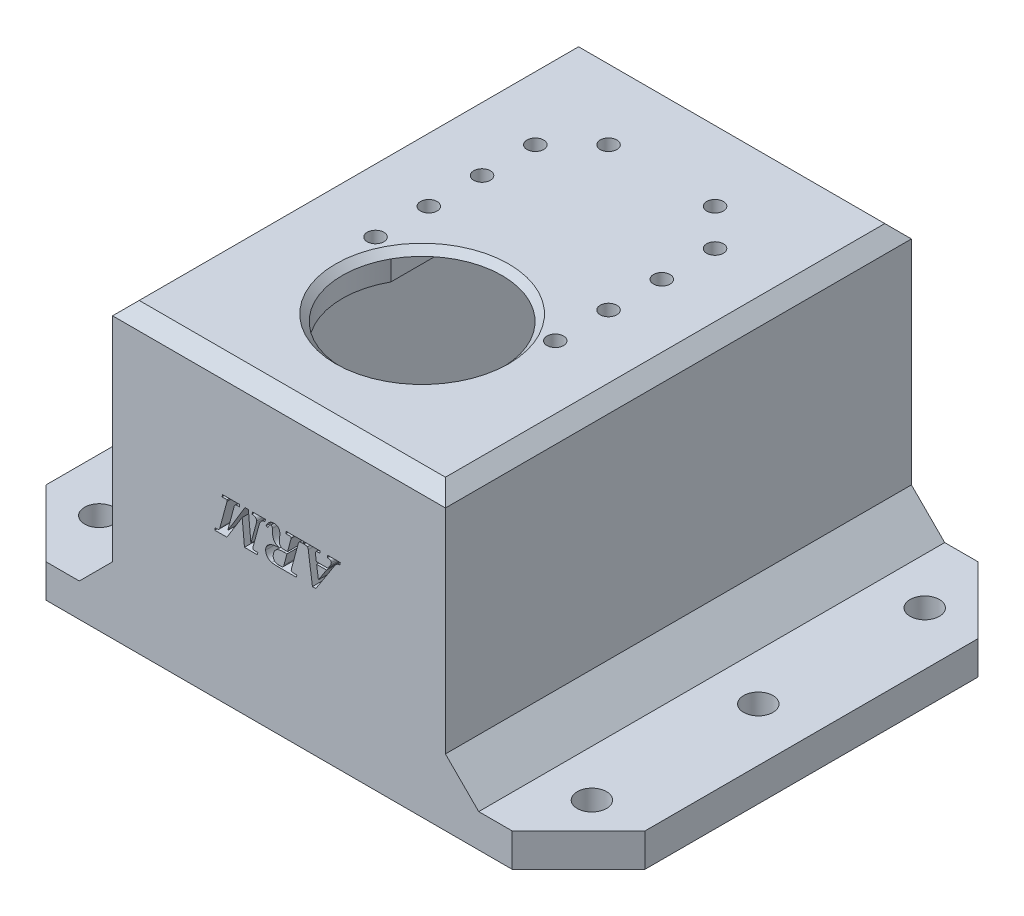
from build123d import *

# Parameters (mm, degrees)
SKETCH1_W           = 50
SKETCH1_H           = 70
BOSS_EXTRUDE1_DEPTH = 4
SKETCH3_R           = 12
CUT_EXTRUDE1_DEPTH  = 44.197222133
CUT_EXTRUDE2_DEPTH  = 3
SKETCH5_R           = 1.25
CUT_EXTRUDE3_DEPTH  = 44.197222133
SKETCH6_W           = 50
SKETCH6_H           = 70
SKETCH6_W_2         = 44
SKETCH6_H_2         = 64
BOSS_EXTRUDE2_DEPTH = 40
CHAMFER1_SIZE       = 2
CHAMFER2_SIZE       = 1
SKETCH7_W           = 20
SKETCH7_H           = 70
SKETCH7_R           = 2.2
BOSS_EXTRUDE3_DEPTH = 5
CHAMFER3_SIZE       = 10
CHAMFER4_SIZE       = 5
CUT_EXTRUDE4_DEPTH  = 5
FILLET1_R           = 2
CUT_EXTRUDE5_DEPTH  = 3


with BuildPart() as part:
    # Sketch1 → Boss-Extrude1 (new body)
    with BuildSketch(Plane(origin=(0, 0, 0), x_dir=(1, 0, 0), z_dir=(0, 1, 0))):
        Rectangle(SKETCH1_W, SKETCH1_H)
    extrude(amount=BOSS_EXTRUDE1_DEPTH)

    # Sketch3 → Cut-Extrude1 (cut, through all)
    with BuildSketch(Plane(origin=(0, 0, 0), x_dir=(-1, 0, 0), z_dir=(0, -1, 0))):
        with Locations(Location((0, -13.5, 0), (0, 0, 90))):
            Circle(SKETCH3_R)
    extrude(amount=-CUT_EXTRUDE1_DEPTH, mode=Mode.SUBTRACT)

    # Sketch4 → Cut-Extrude2 (cut)
    with BuildSketch(Plane(origin=(0, 0, 0), x_dir=(-1, 0, 0), z_dir=(0, -1, 0))):
        with BuildLine():
            Line((-10.5, 18.5), (10.5, 18.5))
            Line((10.5, 18.5), (10.5, -7.690524981))
            ThreePointArc((10.5, -7.690524981), (0, -1.5), (-10.5, -7.690524981))
            Line((-10.5, -7.690524981), (-10.5, 18.5))
        make_face()
    extrude(amount=-CUT_EXTRUDE2_DEPTH, mode=Mode.SUBTRACT)

    # Sketch5 → Cut-Extrude3 (cut, through all)
    with BuildSketch(Plane(origin=(0, 0, 0), x_dir=(-1, 0, 0), z_dir=(0, -1, 0))):
        with Locations(Location((13.5, -7, 0), (0, 0, 90))):
            Circle(SKETCH5_R)
        with Locations(Location((13.5, 1, 0), (0, 0, 90))):
            Circle(SKETCH5_R)
        with Locations(Location((13.5, 9, 0), (0, 0, 90))):
            Circle(SKETCH5_R)
        with Locations(Location((13.5, 17, 0), (0, 0, 90))):
            Circle(SKETCH5_R)
        with Locations(Location((8, 22.5, 0), (0, 0, 90))):
            Circle(SKETCH5_R)
        with Locations(Location((-8, 22.5, 0), (0, 0, 90))):
            Circle(SKETCH5_R)
        with Locations(Location((-13.5, 17, 0), (0, 0, 90))):
            Circle(SKETCH5_R)
        with Locations(Location((-13.5, 9, 0), (0, 0, 90))):
            Circle(SKETCH5_R)
        with Locations(Location((-13.5, 1, 0), (0, 0, 90))):
            Circle(SKETCH5_R)
        with Locations(Location((-13.5, -7, 0), (0, 0, 90))):
            Circle(SKETCH5_R)
    extrude(amount=-CUT_EXTRUDE3_DEPTH, mode=Mode.SUBTRACT)

    # Sketch6 → Boss-Extrude2 (add)
    with BuildSketch(Plane(origin=(0, 0, 0), x_dir=(-1, 0, 0), z_dir=(0, -1, 0))):
        Rectangle(SKETCH6_W, SKETCH6_H)
        Rectangle(SKETCH6_W_2, SKETCH6_H_2, mode=Mode.SUBTRACT)
    extrude(amount=BOSS_EXTRUDE2_DEPTH)

    # Chamfer1
    chamfer1_edges = [part.edges().sort_by_distance(p)[0] for p in [
        (-25, 4, 0),
        (0, 4, 35),
        (25, 4, 0),
        (0, 4, -35),
        (22, 0, 0),
        (0, 0, 32),
        (-22, 0, 0),
        (0, 0, -32),
    ]]
    chamfer(chamfer1_edges, length=CHAMFER1_SIZE)

    # Chamfer2
    chamfer2_edges = [part.edges().sort_by_distance(p)[0] for p in [
        (0, 4, 25.5),
    ]]
    chamfer(chamfer2_edges, length=CHAMFER2_SIZE - 0.0001)  # a hair under: the kernel refuses the full size

    # Sketch7 → Boss-Extrude3 (add)
    # profile 1 of 2: a face of its own
    with BuildSketch(Plane(origin=(0, -40, 0), x_dir=(-1, 0, 0), z_dir=(0, -1, 0))):
        with Locations((-35, 0)):
            Rectangle(SKETCH7_W, SKETCH7_H)
        with Locations(Location((-37, -25, 0), (0, 0, 90))):
            Circle(SKETCH7_R, mode=Mode.SUBTRACT)
        with Locations(Location((-37, 0, 0), (0, 0, 90))):
            Circle(SKETCH7_R, mode=Mode.SUBTRACT)
        with Locations(Location((-37, 25, 0), (0, 0, 90))):
            Circle(SKETCH7_R, mode=Mode.SUBTRACT)
    # profile 2 of 2: a face of its own
    with BuildSketch(Plane(origin=(0, -40, 0), x_dir=(-1, 0, 0), z_dir=(0, -1, 0))):
        with Locations((35, 0)):
            Rectangle(SKETCH7_W, SKETCH7_H)
        with Locations(Location((37, -25, 0), (0, 0, 90))):
            Circle(SKETCH7_R, mode=Mode.SUBTRACT)
        with Locations(Location((37, 0, 0), (0, 0, 90))):
            Circle(SKETCH7_R, mode=Mode.SUBTRACT)
        with Locations(Location((37, 25, 0), (0, 0, 90))):
            Circle(SKETCH7_R, mode=Mode.SUBTRACT)
    extrude(amount=-BOSS_EXTRUDE3_DEPTH)

    # Chamfer3
    chamfer3_edges = [part.edges().sort_by_distance(p)[0] for p in [
        (45, -37.5, -35),
        (45, -37.5, 35),
        (-45, -37.5, -35),
        (-45, -37.5, 35),
    ]]
    chamfer(chamfer3_edges, length=CHAMFER3_SIZE)

    # Chamfer4
    chamfer4_edges = [part.edges().sort_by_distance(p)[0] for p in [
        (25, -35, 0),
        (-25, -35, 0),
    ]]
    chamfer(chamfer4_edges, length=CHAMFER4_SIZE)

    # Sketch8 → Cut-Extrude4 (cut)
    with BuildSketch(Plane(origin=(0, 0, -35), x_dir=(-1, 0, 0), z_dir=(0, 0, -1))):
        Polygon((0, -40), (10, -40), (10, -35), (-10, -35), (-10, -40), align=None)
    extrude(amount=-CUT_EXTRUDE4_DEPTH, mode=Mode.SUBTRACT)

    # Fillet1
    fillet1_edges = [part.edges().sort_by_distance(p)[0] for p in [
        (10, -40, -33.5),
        (10, -35, -33.5),
        (-10, -35, -33.5),
        (-10, -40, -33.5),
    ]]
    fillet(fillet1_edges, radius=FILLET1_R)

    # Sketch9 → Cut-Extrude5 (cut)
    # profile 1 of 3: a face of its own
    with BuildSketch(Plane.XY.offset(35)):
        with BuildLine():
            Line((-3.26410099, -18.215874566), (-5.189753399, -18.215874566))
            Line((-5.189753399, -18.215874566), (-5.53141826, -14.503534355))
            Line((-5.53141826, -14.503534355), (-7.826946389, -18.215874566))
            Line((-7.826946389, -18.215874566), (-9.658562598, -18.215874566))
            Line((-9.658562598, -18.215874566), (-9.566616091, -17.881523632))
            Line((-9.566616091, -17.881523632), (-9.355557064, -17.881523632))
            add(Edge.make_bspline(
                [(-9.355557064, -17.881523632), (-9.324122948, -17.880741849), (-9.264237919, -17.879252478), (-9.17937637, -17.862058127), (-9.104120789, -17.835004896), (-9.037774986, -17.797400665), (-8.982606375, -17.74686746), (-8.936914689, -17.686011916), (-8.900869529, -17.614192881), (-8.886530434, -17.561084352), (-8.879106983, -17.533589692)],
                knots=[0, 0, 0, 0, 1.166550711, 2.222391886, 3.200926143, 4.12876701, 5.035888217, 5.959930519, 6.943841612, 8, 8, 8, 8], degree=3))
            Line((-8.879106983, -17.533589692), (-7.822767002, -13.609145607))
            add(Edge.make_bspline(
                [(-7.822767002, -13.609145607), (-7.819454863, -13.595280033), (-7.812971938, -13.568140633), (-7.812533147, -13.540245952), (-7.812318536, -13.526602721)],
                knots=[0, 0, 0, 0, 1.021804027, 2, 2, 2, 2], degree=3))
            add(Edge.make_bspline(
                [(-7.812318536, -13.526602721), (-7.813136648, -13.512586829), (-7.814701406, -13.485779406), (-7.826127896, -13.44823119), (-7.846451918, -13.416167576), (-7.866112159, -13.40138342), (-7.876054182, -13.393907194)],
                knots=[0, 0, 0, 0, 1.093673978, 2.091810004, 3.035043977, 4, 4, 4, 4], degree=3))
            add(Edge.make_bspline(
                [(-7.876054182, -13.393907194), (-7.89037957, -13.384622692), (-7.920004611, -13.365422252), (-7.972040587, -13.347108987), (-8.030981666, -13.33690247), (-8.072439795, -13.335235181), (-8.094427136, -13.334350934)],
                knots=[0, 0, 0, 0, 0.888245984, 1.836901271, 2.852799465, 4, 4, 4, 4], degree=3))
            Line((-8.094427136, -13.334350934), (-8.56042875, -13.334350934))
            Line((-8.56042875, -13.334350934), (-8.468482243, -13))
            Line((-8.468482243, -13), (-5.8950249, -13))
            Line((-5.8950249, -13), (-5.972343554, -13.334350934))
            Line((-5.972343554, -13.334350934), (-6.289976941, -13.334350934))
            add(Edge.make_bspline(
                [(-6.289976941, -13.334350934), (-6.317890308, -13.335010241), (-6.371300064, -13.336271767), (-6.4474894, -13.349709155), (-6.514647027, -13.373217478), (-6.575072264, -13.402727662), (-6.624608217, -13.444904502), (-6.666318276, -13.494886171), (-6.699035263, -13.554233621), (-6.713171508, -13.59806122), (-6.720453768, -13.620638921)],
                knots=[0, 0, 0, 0, 1.190709943, 2.278318021, 3.284337852, 4.221795374, 5.129674893, 6.037554411, 6.989050012, 8, 8, 8, 8], degree=3))
            Line((-6.720453768, -13.620638921), (-7.704699329, -17.277602258))
            Line((-7.704699329, -17.277602258), (-5.112434746, -13))
            Line((-5.112434746, -13), (-4.601504725, -13))
            Line((-4.601504725, -13), (-4.223270232, -17.186700598))
            Line((-4.223270232, -17.186700598), (-3.411424371, -14.202618515))
            add(Edge.make_bspline(
                [(-3.411424371, -14.202618515), (-3.398463414, -14.149240483), (-3.373684175, -14.047190377), (-3.368817222, -13.942317452), (-3.366495964, -13.892299054)],
                knots=[0, 0, 0, 0, 1.046114187, 2, 2, 2, 2], degree=3))
            add(Edge.make_bspline(
                [(-3.366495964, -13.892299054), (-3.368210141, -13.850619407), (-3.371495832, -13.770728954), (-3.404483935, -13.65877322), (-3.458968977, -13.562599651), (-3.535786928, -13.482848867), (-3.6351676, -13.421001744), (-3.754778429, -13.374269611), (-3.895609637, -13.344572431), (-3.996389846, -13.337892681), (-4.049825685, -13.334350934)],
                knots=[0, 0, 0, 0, 1.000668556, 1.918055173, 2.777591848, 3.636924275, 4.552740514, 5.571937359, 6.712588851, 8, 8, 8, 8], degree=3))
            Line((-4.049825685, -13.334350934), (-3.965193105, -13))
            Line((-3.965193105, -13), (-2.030137076, -13))
            Line((-2.030137076, -13), (-2.117904196, -13.334350934))
            add(Edge.make_bspline(
                [(-2.117904196, -13.334350934), (-2.166348361, -13.339489201), (-2.26049577, -13.349475019), (-2.393474178, -13.394909274), (-2.516301988, -13.457313742), (-2.584993243, -13.517384207), (-2.619430596, -13.547499654)],
                knots=[0, 0, 0, 0, 1.048345878, 2.037377405, 3.016067937, 4, 4, 4, 4], degree=3))
            add(Edge.make_bspline(
                [(-2.619430596, -13.547499654), (-2.662980965, -13.593716195), (-2.749794248, -13.685844224), (-2.855291518, -13.84528964), (-2.94158691, -14.018554742), (-2.980182691, -14.142765319), (-2.999754783, -14.205753055)],
                knots=[0, 0, 0, 0, 0.989609555, 1.972687161, 2.971940654, 4, 4, 4, 4], degree=3))
            Line((-2.999754783, -14.205753055), (-3.912950771, -17.559710859))
            add(Edge.make_bspline(
                [(-3.912950771, -17.559710859), (-3.919035597, -17.580811249), (-3.930373542, -17.620127909), (-3.932747703, -17.660953045), (-3.933847705, -17.679868225)],
                knots=[0, 0, 0, 0, 1.073356181, 2, 2, 2, 2], degree=3))
            add(Edge.make_bspline(
                [(-3.933847705, -17.679868225), (-3.933200374, -17.694954161), (-3.931951035, -17.724069848), (-3.917807488, -17.765229422), (-3.893955241, -17.800309151), (-3.861483806, -17.831172397), (-3.816888845, -17.85377532), (-3.761042299, -17.870225186), (-3.693190998, -17.880318502), (-3.643765641, -17.881102942), (-3.617259164, -17.881523632)],
                knots=[0, 0, 0, 0, 0.84926519, 1.63907239, 2.419025092, 3.226027719, 4.1410525, 5.210968693, 6.504261795, 8, 8, 8, 8], degree=3))
            Line((-3.617259164, -17.881523632), (-3.17633387, -17.881523632))
            Line((-3.17633387, -17.881523632), (-3.26410099, -18.215874566))
        make_face()
    # profile 2 of 3: a face of its own
    with BuildSketch(Plane.XY.offset(35)):
        with BuildLine():
            Line((2.588085196, -18.215874566), (-0.2507632, -18.215874566))
            add(Edge.make_bspline(
                [(-0.2507632, -18.215874566), (-0.294652495, -18.215799934), (-0.380014893, -18.215654778), (-0.504349852, -18.210916398), (-0.621144775, -18.205509772), (-0.730373502, -18.194992996), (-0.832091217, -18.186199718), (-0.925958538, -18.170474986), (-1.012220294, -18.154609706), (-1.066846505, -18.140911958), (-1.092909615, -18.134376526)],
                knots=[0, 0, 0, 0, 1.241599428, 2.414846425, 3.520038092, 4.548648127, 5.519320514, 6.407079454, 7.239990071, 8, 8, 8, 8], degree=3))
            add(Edge.make_bspline(
                [(-1.092909615, -18.134376526), (-1.127589841, -18.124160464), (-1.195730068, -18.104087793), (-1.293038194, -18.06447022), (-1.385500534, -18.02135958), (-1.471362037, -17.970105916), (-1.553344806, -17.915569755), (-1.628411653, -17.853104733), (-1.699171429, -17.786540351), (-1.762227757, -17.713052784), (-1.820397946, -17.636295092), (-1.869080784, -17.553699748), (-1.912778982, -17.468852992), (-1.945326986, -17.378886461), (-1.973394994, -17.287093648), (-1.99171778, -17.191106146), (-2.003614287, -17.091570999), (-2.005265423, -17.023740206), (-2.006105602, -16.989224578)],
                knots=[0, 0, 0, 0, 1.096142282, 2.153716732, 3.184019871, 4.187979413, 5.184404338, 6.167973084, 7.14699088, 8.128059216, 9.102275634, 10.064499821, 11.033199811, 11.992867976, 12.962431977, 13.942589492, 14.953088834, 16, 16, 16, 16], degree=3))
            add(Edge.make_bspline(
                [(-2.006105602, -16.989224578), (-2.003706651, -16.927317116), (-1.998973367, -16.805169724), (-1.954939891, -16.627971405), (-1.886991533, -16.460274084), (-1.806161987, -16.331225957), (-1.728883977, -16.235195023), (-1.664975853, -16.165328553), (-1.593568872, -16.100851363), (-1.516125906, -16.039980411), (-1.431878551, -15.983844406), (-1.342283436, -15.929709472), (-1.244613786, -15.882868979), (-1.141116447, -15.836442371), (-1.027672119, -15.79581748), (-0.902707973, -15.760307679), (-0.765764369, -15.730636677), (-0.616917483, -15.704656377), (-0.456003751, -15.682261365), (-0.28262228, -15.667659286), (-0.097298093, -15.655817091), (0.030283281, -15.651802838), (0.096125893, -15.64973115)],
                knots=[0, 0, 0, 0, 1.32760526, 2.619450295, 3.897468627, 5.201042269, 5.871617394, 6.543900993, 7.232264597, 7.935585634, 8.657593976, 9.405526331, 10.18165637, 10.982203869, 11.841153193, 12.766947128, 13.770609989, 14.849169902, 16.011819845, 17.258633105, 18.585226406, 20, 20, 20, 20], degree=3))
            add(Edge.make_bspline(
                [(0.096125893, -15.64973115), (0.030609193, -15.634032118), (-0.094645979, -15.604018626), (-0.268379141, -15.539407362), (-0.418518901, -15.460177723), (-0.545892917, -15.36571359), (-0.651771539, -15.255404131), (-0.74237293, -15.132065306), (-0.817986908, -14.994064677), (-0.867847884, -14.86633812), (-0.901255443, -14.750331386), (-0.922026441, -14.644977577), (-0.941870059, -14.523366375), (-0.959701953, -14.385055245), (-0.973629603, -14.229910966), (-0.986161349, -14.057836307), (-0.996785955, -13.869403912), (-1.000909768, -13.738022195), (-1.003052801, -13.669746714)],
                knots=[0, 0, 0, 0, 1.285574019, 2.457767159, 3.528843741, 4.517066248, 5.471759818, 6.43741559, 7.431505619, 8.467616445, 9.048587799, 9.734624208, 10.516328357, 11.401406466, 12.396652517, 13.490203113, 14.695727293, 16, 16, 16, 16], degree=3))
            add(Edge.make_bspline(
                [(-1.003052801, -13.669746714), (-1.004327711, -13.643587943), (-1.006718066, -13.594542315), (-1.017035242, -13.525880753), (-1.032337898, -13.467671067), (-1.051580421, -13.418869898), (-1.078071741, -13.381117056), (-1.110122264, -13.354106881), (-1.147774935, -13.336845578), (-1.174914223, -13.335204717), (-1.189035508, -13.334350934)],
                knots=[0, 0, 0, 0, 1.476429038, 2.768187782, 3.906922628, 4.866375339, 5.711214853, 6.47826415, 7.20820084, 8, 8, 8, 8], degree=3))
            add(Edge.make_bspline(
                [(-1.189035508, -13.334350934), (-1.209131138, -13.336083173), (-1.251141643, -13.339704469), (-1.312954119, -13.367476504), (-1.374998753, -13.410005475), (-1.436627846, -13.470201006), (-1.499273905, -13.545819953), (-1.561478015, -13.63880188), (-1.625283041, -13.747685985), (-1.665260144, -13.827265593), (-1.686382522, -13.869312428)],
                knots=[0, 0, 0, 0, 0.63179665, 1.320789496, 2.103211758, 2.996100132, 4.024857041, 5.19395179, 6.517390997, 8, 8, 8, 8], degree=3))
            Line((-1.686382522, -13.869312428), (-1.939235416, -13.804531934))
            add(Edge.make_bspline(
                [(-1.939235416, -13.804531934), (-1.923413832, -13.766315415), (-1.892511136, -13.691670962), (-1.837899448, -13.586269779), (-1.783471146, -13.486254355), (-1.723425253, -13.394582068), (-1.661392845, -13.309179354), (-1.593533116, -13.233330242), (-1.524907982, -13.162354445), (-1.451856592, -13.099669018), (-1.374560874, -13.045057976), (-1.294671047, -12.996569784), (-1.210158379, -12.95734877), (-1.123668158, -12.923020112), (-1.03302742, -12.898756719), (-0.939701158, -12.879033105), (-0.842353148, -12.869209985), (-0.776337306, -12.867251847), (-0.742885981, -12.866259627)],
                knots=[0, 0, 0, 0, 1.220456451, 2.383793883, 3.502285087, 4.580300337, 5.616718503, 6.6148953, 7.581871331, 8.5298013, 9.451323229, 10.373533203, 11.284149845, 12.198762853, 13.116779244, 14.050381991, 15.012096126, 16, 16, 16, 16], degree=3))
            add(Edge.make_bspline(
                [(-0.742885981, -12.866259627), (-0.709070265, -12.867097726), (-0.643326731, -12.868727136), (-0.547854984, -12.880297489), (-0.458072637, -12.8993768), (-0.373590785, -12.924634915), (-0.295137009, -12.959741452), (-0.22335204, -13.002751374), (-0.156266309, -13.052219892), (-0.096141394, -13.109892238), (-0.041354055, -13.173600005), (0.00552795, -13.243982646), (0.045715888, -13.319846106), (0.078035601, -13.401886872), (0.10319718, -13.490087824), (0.120193259, -13.584272502), (0.132693303, -13.684043483), (0.133385008, -13.752595559), (0.133740373, -13.787814388)],
                knots=[0, 0, 0, 0, 1.123913405, 2.185079854, 3.190938341, 4.172315121, 5.110329589, 6.039515321, 6.949462376, 7.874817887, 8.802776779, 9.737140675, 10.679645152, 11.651346199, 12.662719193, 13.723064379, 14.830217708, 16, 16, 16, 16], degree=3))
            add(Edge.make_bspline(
                [(0.133740373, -13.787814388), (0.132880832, -13.825434924), (0.131001445, -13.907692168), (0.123572657, -14.042233583), (0.109485331, -14.198590507), (0.097364099, -14.310258269), (0.09090166, -14.369793982)],
                knots=[0, 0, 0, 0, 0.773466488, 1.691183297, 2.769053435, 4, 4, 4, 4], degree=3))
            add(Edge.make_bspline(
                [(0.09090166, -14.369793982), (0.085241102, -14.423770232), (0.074946503, -14.521934371), (0.062259297, -14.654231673), (0.053879039, -14.757325763), (0.052726101, -14.816282055), (0.052242333, -14.841019829)],
                knots=[0, 0, 0, 0, 1.376937771, 2.504173747, 3.372358554, 4, 4, 4, 4], degree=3))
            add(Edge.make_bspline(
                [(0.052242333, -14.841019829), (0.054268948, -14.894850264), (0.058116727, -14.99705405), (0.091570646, -15.140387744), (0.14696549, -15.263908218), (0.226253723, -15.36590632), (0.326100771, -15.44524873), (0.444736948, -15.501500453), (0.580850286, -15.535101193), (0.677555811, -15.539015068), (0.728258128, -15.541067096)],
                knots=[0, 0, 0, 0, 1.165345182, 2.212552994, 3.168314921, 4.077239324, 4.984909257, 5.906531705, 6.902403027, 8, 8, 8, 8], degree=3))
            Line((0.728258128, -15.541067096), (1.287251095, -15.541067096))
            Line((1.287251095, -15.541067096), (1.813853815, -13.585114134))
            add(Edge.make_bspline(
                [(1.813853815, -13.585114134), (1.817165274, -13.57510357), (1.823676538, -13.555419974), (1.824096099, -13.53469689), (1.824302282, -13.524513027)],
                knots=[0, 0, 0, 0, 1.017147898, 2, 2, 2, 2], degree=3))
            add(Edge.make_bspline(
                [(1.824302282, -13.524513027), (1.823590109, -13.510821549), (1.822182643, -13.483763125), (1.808359923, -13.445787654), (1.784854939, -13.412806454), (1.753123916, -13.384646962), (1.712125295, -13.361044512), (1.660974914, -13.344685138), (1.599618591, -13.335886457), (1.555458011, -13.334887397), (1.531745215, -13.334350934)],
                knots=[0, 0, 0, 0, 0.834748203, 1.649710225, 2.429419945, 3.288787792, 4.223702676, 5.301007343, 6.550728643, 8, 8, 8, 8], degree=3))
            Line((1.531745215, -13.334350934), (1.023949735, -13.334350934))
            Line((1.023949735, -13.334350934), (1.098133848, -13))
            Line((1.098133848, -13), (3.694577818, -13))
            Line((3.694577818, -13), (3.606810697, -13.334350934))
            Line((3.606810697, -13.334350934), (3.310074244, -13.334350934))
            add(Edge.make_bspline(
                [(3.310074244, -13.334350934), (3.282471077, -13.334829292), (3.230299033, -13.335733425), (3.157507174, -13.35095114), (3.094410567, -13.373276978), (3.041001217, -13.406631965), (2.997211892, -13.451947409), (2.958242793, -13.506590447), (2.925995783, -13.573590171), (2.909986513, -13.622855077), (2.901539197, -13.648849781)],
                knots=[0, 0, 0, 0, 1.169898951, 2.211196231, 3.14249037, 4.000049606, 4.857608843, 5.801501221, 6.839958737, 8, 8, 8, 8], degree=3))
            Line((2.901539197, -13.648849781), (1.861916762, -17.510603065))
            add(Edge.make_bspline(
                [(1.861916762, -17.510603065), (1.855041252, -17.537978084), (1.841594407, -17.591517039), (1.839102875, -17.646654188), (1.837885289, -17.673599145)],
                knots=[0, 0, 0, 0, 1.022620612, 2, 2, 2, 2], degree=3))
            add(Edge.make_bspline(
                [(1.837885289, -17.673599145), (1.838495022, -17.689736433), (1.839660161, -17.720573162), (1.853973844, -17.763986878), (1.877073457, -17.801150664), (1.910351159, -17.832095674), (1.954638908, -17.855088785), (2.010928021, -17.869801234), (2.078497747, -17.880458582), (2.127951906, -17.881151842), (2.154473829, -17.881523632)],
                knots=[0, 0, 0, 0, 0.894223004, 1.708770014, 2.509384178, 3.3041209, 4.205237911, 5.253360119, 6.526996024, 8, 8, 8, 8], degree=3))
            Line((2.154473829, -17.881523632), (2.676897163, -17.881523632))
            Line((2.676897163, -17.881523632), (2.588085196, -18.215874566))
        make_face()
        with BuildLine():
            Line((1.197394281, -15.87541803), (0.668701867, -15.87541803))
            add(Edge.make_bspline(
                [(0.668701867, -15.87541803), (0.604243249, -15.876445331), (0.480026435, -15.878425021), (0.300573353, -15.892812696), (0.135773567, -15.91759715), (-0.015081319, -15.951619525), (-0.151229044, -15.996405167), (-0.27351344, -16.050519595), (-0.381647834, -16.114826404), (-0.443316286, -16.16745143), (-0.473315541, -16.193051417)],
                knots=[0, 0, 0, 0, 1.276663499, 2.460230717, 3.562674875, 4.57506719, 5.519639496, 6.396573342, 7.219996557, 8, 8, 8, 8], degree=3))
            add(Edge.make_bspline(
                [(-0.473315541, -16.193051417), (-0.505013289, -16.224450429), (-0.567573664, -16.286421202), (-0.648707788, -16.390104281), (-0.717278583, -16.501497506), (-0.771961093, -16.621185391), (-0.817177541, -16.747387306), (-0.846228052, -16.881964111), (-0.86603315, -17.023464957), (-0.868203913, -17.120454625), (-0.869312428, -17.169983051)],
                knots=[0, 0, 0, 0, 0.985215004, 1.944473082, 2.901505357, 3.86912582, 4.847674003, 5.857827588, 6.906085249, 8, 8, 8, 8], degree=3))
            add(Edge.make_bspline(
                [(-0.869312428, -17.169983051), (-0.868836868, -17.201360894), (-0.867914567, -17.262215147), (-0.85716946, -17.350691563), (-0.839808167, -17.433384378), (-0.814562564, -17.509981341), (-0.783112805, -17.580363973), (-0.745676113, -17.645389436), (-0.698705707, -17.702637427), (-0.646372172, -17.755835279), (-0.584923103, -17.802758936), (-0.512432252, -17.840915331), (-0.430978598, -17.874445173), (-0.339386975, -17.900890756), (-0.238698229, -17.923534918), (-0.127742353, -17.936851129), (-0.007150354, -17.946922301), (0.076596835, -17.947890314), (0.120157367, -17.948393819)],
                knots=[0, 0, 0, 0, 1.037602206, 2.012327873, 2.943443953, 3.828879977, 4.674745509, 5.490894197, 6.302475157, 7.11723992, 7.956091585, 8.84810087, 9.819551974, 10.865819067, 11.998136912, 13.230130207, 14.559271026, 16, 16, 16, 16], degree=3))
            add(Edge.make_bspline(
                [(0.120157367, -17.948393819), (0.149065938, -17.948183102), (0.204115705, -17.94778184), (0.282575203, -17.94507639), (0.352977833, -17.938702936), (0.414958474, -17.930291727), (0.46928292, -17.921463703), (0.515605307, -17.909123872), (0.553772406, -17.893849274), (0.59531963, -17.870811376), (0.638273625, -17.827780033), (0.678757838, -17.758970327), (0.715950026, -17.672427303), (0.732080321, -17.606712832), (0.740796288, -17.571204172)],
                knots=[0, 0, 0, 0, 1.263205039, 2.405485267, 3.429187216, 4.350361851, 5.138484167, 5.832542393, 6.440129286, 6.930902564, 7.899624105, 9.048172313, 10.404986846, 12, 12, 12, 12], degree=3))
            Line((0.740796288, -17.571204172), (1.197394281, -15.87541803))
        make_face(mode=Mode.SUBTRACT)
    # profile 3 of 3: a face of its own
    with BuildSketch(Plane.XY.offset(35)):
        with BuildLine():
            Line((5.53141826, -18.215874566), (5.024667626, -18.215874566))
            Line((5.024667626, -18.215874566), (4.392535392, -13.725123587))
            add(Edge.make_bspline(
                [(4.392535392, -13.725123587), (4.387218585, -13.693544229), (4.377284188, -13.63453854), (4.349192811, -13.554736756), (4.311073196, -13.489195145), (4.275683882, -13.457933839), (4.258795018, -13.443014987)],
                knots=[0, 0, 0, 0, 1.198453078, 2.239296642, 3.159738488, 4, 4, 4, 4], degree=3))
            add(Edge.make_bspline(
                [(4.258795018, -13.443014987), (4.232565112, -13.425831985), (4.178952019, -13.390710476), (4.083724073, -13.35860775), (3.978046241, -13.33688851), (3.902980763, -13.335220568), (3.863842978, -13.334350934)],
                knots=[0, 0, 0, 0, 0.900420987, 1.840431814, 2.874040147, 4, 4, 4, 4], degree=3))
            Line((3.863842978, -13.334350934), (3.700846898, -13.334350934))
            Line((3.700846898, -13.334350934), (3.789658864, -13))
            Line((3.789658864, -13), (6.198030434, -13))
            Line((6.198030434, -13), (6.116532394, -13.334350934))
            Line((6.116532394, -13.334350934), (5.940998153, -13.334350934))
            add(Edge.make_bspline(
                [(5.940998153, -13.334350934), (5.898131115, -13.335024886), (5.819835468, -13.336255843), (5.713117257, -13.347785792), (5.62820958, -13.368628636), (5.562882087, -13.398826554), (5.516398856, -13.439852086), (5.483418013, -13.488933296), (5.464615695, -13.547944588), (5.462512255, -13.590205406), (5.461413533, -13.612280147)],
                knots=[0, 0, 0, 0, 1.628814443, 2.974991611, 4.06969577, 4.939816176, 5.680643804, 6.396457342, 7.162396983, 8, 8, 8, 8], degree=3))
            add(Edge.make_bspline(
                [(5.461413533, -13.612280147), (5.462217079, -13.629716039), (5.463957818, -13.667487763), (5.469095783, -13.704952846), (5.471862, -13.725123587)],
                knots=[0, 0, 0, 0, 0.923224535, 2, 2, 2, 2], degree=3))
            Line((5.471862, -13.725123587), (5.604557526, -14.671754669))
            Line((5.604557526, -14.671754669), (7.353630848, -14.671754669))
            Line((7.353630848, -14.671754669), (7.706789022, -14.124255015))
            add(Edge.make_bspline(
                [(7.706789022, -14.124255015), (7.729035201, -14.087151501), (7.771299847, -14.016659984), (7.816246761, -13.907925596), (7.845905743, -13.804356206), (7.850032617, -13.736097855), (7.852022709, -13.703181807)],
                knots=[0, 0, 0, 0, 1.14988981, 2.184630764, 3.124579206, 4, 4, 4, 4], degree=3))
            add(Edge.make_bspline(
                [(7.852022709, -13.703181807), (7.850621912, -13.675550739), (7.847935273, -13.622556106), (7.827349282, -13.547238263), (7.789234387, -13.483030021), (7.737892642, -13.428283921), (7.671237502, -13.384519509), (7.589009155, -13.354968272), (7.492280144, -13.33756077), (7.423020058, -13.335468586), (7.386021095, -13.334350934)],
                knots=[0, 0, 0, 0, 0.980699502, 1.880919314, 2.739852318, 3.605876736, 4.52500638, 5.54243738, 6.687162051, 8, 8, 8, 8], degree=3))
            Line((7.386021095, -13.334350934), (7.241832255, -13.334350934))
            Line((7.241832255, -13.334350934), (7.322285448, -13))
            Line((7.322285448, -13), (9.213457917, -13))
            Line((9.213457917, -13), (9.131959877, -13.334350934))
            add(Edge.make_bspline(
                [(9.131959877, -13.334350934), (9.093489179, -13.337504599), (9.020020949, -13.343527214), (8.91703555, -13.368289614), (8.825026328, -13.401304695), (8.772723931, -13.435064284), (8.747456303, -13.451373761)],
                knots=[0, 0, 0, 0, 1.136289944, 2.169994724, 3.115912585, 4, 4, 4, 4], degree=3))
            add(Edge.make_bspline(
                [(8.747456303, -13.451373761), (8.70428613, -13.483288341), (8.621047451, -13.54482452), (8.511114053, -13.647592432), (8.415271998, -13.751263149), (8.363866052, -13.82652328), (8.338921256, -13.863043348)],
                knots=[0, 0, 0, 0, 1.103396204, 2.127516181, 3.091375012, 4, 4, 4, 4], degree=3))
            Line((8.338921256, -13.863043348), (5.53141826, -18.215874566))
        make_face()
        Polygon((5.918011527, -16.897278071), (7.137347588, -15.006105602), (5.651575626, -15.006105602), align=None, mode=Mode.SUBTRACT)
    extrude(amount=-CUT_EXTRUDE5_DEPTH, mode=Mode.SUBTRACT)


with BuildPart() as cut_extrude5_piece_1:
    # of the separate pieces the step leaves, piece 1, a body of its own (cut_extrude5_pieces)
    add(part.part.solids().sort_by_distance((-12, -40, -35))[0])


with BuildPart() as cut_extrude5_piece_2:
    # of the separate pieces the step leaves, piece 2, a body of its own (cut_extrude5_pieces)
    add(part.part.solids().sort_by_distance((0.740796288, -17.571204172, 32))[0])


with BuildPart() as cut_extrude5_piece_3:
    # of the separate pieces the step leaves, piece 3, a body of its own (cut_extrude5_pieces)
    add(part.part.solids().sort_by_distance((5.651575626, -15.006105602, 32))[0])


solid = Compound([cut_extrude5_piece_1.part, cut_extrude5_piece_2.part, cut_extrude5_piece_3.part])
